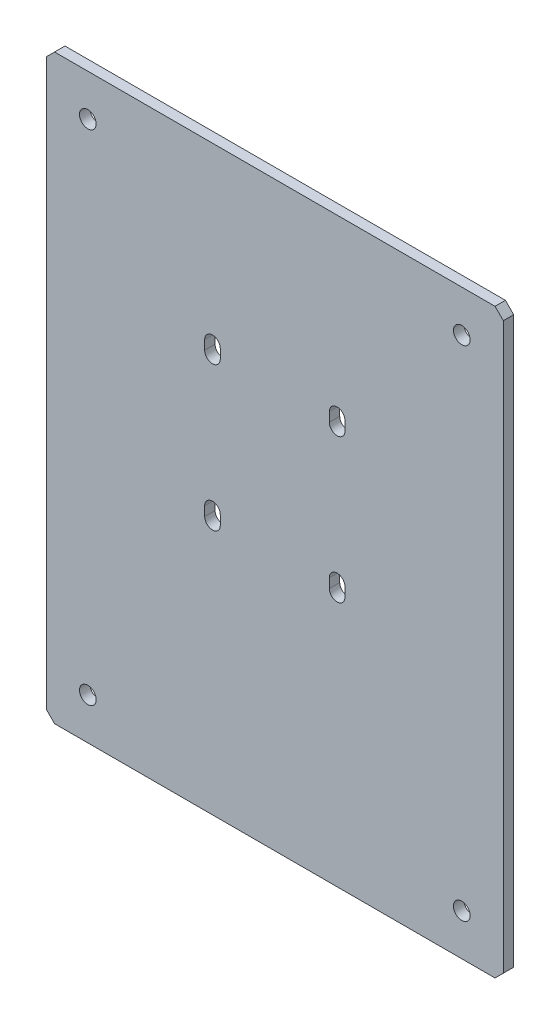
from build123d import *

# Parameters (mm, degrees)
SKETCH1_W              = 139.7
SKETCH1_H              = 177.8
BOSS_EXTRUDE1_DEPTH    = 3.175
CUT_EXTRUDE1_DEPTH     = 227.13936107
F_10_CLEARANCE_HOLE1_D = 5.1054
CHAMFER1_SIZE          = 2.54


with BuildPart() as part:
    # Sketch1 → Boss-Extrude1 (new body)
    with BuildSketch(Plane.XY):
        with Locations((69.85, 88.9)):
            Rectangle(SKETCH1_W, SKETCH1_H)
    extrude(amount=-BOSS_EXTRUDE1_DEPTH)

    # Sketch2 → Cut-Extrude1 (cut, through all)
    with BuildSketch(Plane.XY):
        with BuildLine():
            Line((48.41875, 121.7875), (48.41875, 124.645))
            ThreePointArc((48.41875, 124.645), (50.8, 127.02625), (53.18125, 124.645))
            Line((53.18125, 124.645), (53.18125, 121.7875))
            ThreePointArc((53.18125, 121.7875), (50.8, 119.40625), (48.41875, 121.7875))
        make_face()
        with BuildLine():
            Line((48.41875, 77.7875), (48.41875, 80.645))
            ThreePointArc((48.41875, 80.645), (50.8, 83.02625), (53.18125, 80.645))
            Line((53.18125, 80.645), (53.18125, 77.7875))
            ThreePointArc((53.18125, 77.7875), (50.8, 75.40625), (48.41875, 77.7875))
        make_face()
        with BuildLine():
            Line((91.28125, 121.7875), (91.28125, 124.645))
            ThreePointArc((91.28125, 124.645), (88.9, 127.02625), (86.51875, 124.645))
            Line((86.51875, 124.645), (86.51875, 121.7875))
            ThreePointArc((86.51875, 121.7875), (88.9, 119.40625), (91.28125, 121.7875))
        make_face()
        with BuildLine():
            Line((91.28125, 77.7875), (91.28125, 80.645))
            ThreePointArc((91.28125, 80.645), (88.9, 83.02625), (86.51875, 80.645))
            Line((86.51875, 80.645), (86.51875, 77.7875))
            ThreePointArc((86.51875, 77.7875), (88.9, 75.40625), (91.28125, 77.7875))
        make_face()
    extrude(amount=-CUT_EXTRUDE1_DEPTH, mode=Mode.SUBTRACT)

    # #10 Clearance Hole1 (through all)
    with Locations(Plane.XY):
        with Locations((12.7, 12.7), (12.7, 165.1), (127, 165.1), (127, 12.7)):
            Hole(F_10_CLEARANCE_HOLE1_D / 2)

    # Chamfer1
    chamfer1_edges = [part.edges().sort_by_distance(p)[0] for p in [
        (0, 0, -1.5875),
        (139.7, 0, -1.5875),
        (139.7, 177.8, -1.5875),
        (0, 177.8, -1.5875),
    ]]
    chamfer(chamfer1_edges, length=CHAMFER1_SIZE)


solid = part.part
